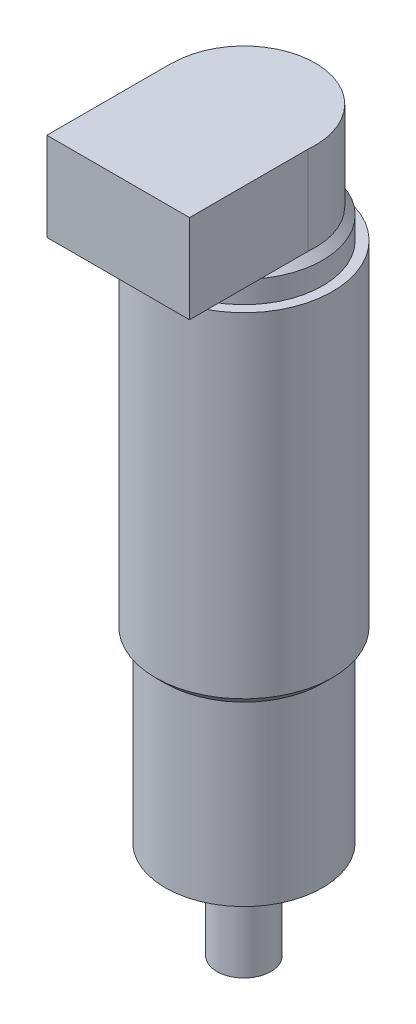
from build123d import *

# Parameters (mm, degrees)
ESQUISSE1_R        = 16
BOSS_EXTRU_1_DEPTH = 36
ESQUISSE2_R        = 18
BOSS_EXTRU_2_DEPTH = 70
CHANFREIN1_SIZE    = 2
ESQUISSE3_R        = 16
BOSS_EXTRU_3_DEPTH = 6
ESQUISSE4_R        = 14.5
BOSS_EXTRU_4_DEPTH = 18
CHANFREIN2_SIZE    = 1.5
ESQUISSE5_W        = 29
ESQUISSE5_H        = 18
BOSS_EXTRU_5_DEPTH = 25.5
ESQUISSE6_R        = 5.5
BOSS_EXTRU_6_DEPTH = 20


with BuildPart() as part:
    # Esquisse1 → Boss.-Extru.1 (new body)
    with BuildSketch(Plane(origin=(0, 0, 0), x_dir=(1, 0, 0), z_dir=(0, 1, 0))):
        with Locations(Location((0, 0, 0), (0, 0, 270))):
            Circle(ESQUISSE1_R)
    extrude(amount=BOSS_EXTRU_1_DEPTH)

    # Esquisse2 → Boss.-Extru.2 (add)
    with BuildSketch(Plane(origin=(0, 36, 0), x_dir=(1, 0, 0), z_dir=(0, 1, 0))):
        with Locations(Location((0, 0, 0), (0, 0, 270))):
            Circle(ESQUISSE2_R)
    extrude(amount=BOSS_EXTRU_2_DEPTH)

    # Chanfrein1
    chanfrein1_edges = [part.edges().sort_by_distance(p)[0] for p in [
        (0, 36, -18),
    ]]
    chamfer(chanfrein1_edges, length=CHANFREIN1_SIZE - 0.0001)  # a hair under: the kernel refuses the full size

    # Esquisse3 → Boss.-Extru.3 (add)
    with BuildSketch(Plane(origin=(0, 106, 0), x_dir=(1, 0, 0), z_dir=(0, 1, 0))):
        with Locations(Location((0, 0, 0), (0, 0, 270))):
            Circle(ESQUISSE3_R)
    extrude(amount=BOSS_EXTRU_3_DEPTH)

    # Esquisse4 → Boss.-Extru.4 (add)
    with BuildSketch(Plane(origin=(0, 112, 0), x_dir=(1, 0, 0), z_dir=(0, 1, 0))):
        with Locations(Location((0, 0, 0), (0, 0, 270))):
            Circle(ESQUISSE4_R)
    extrude(amount=BOSS_EXTRU_4_DEPTH)

    # Chanfrein2
    chanfrein2_edges = [part.edges().sort_by_distance(p)[0] for p in [
        (0, 112, -16),
    ]]
    chamfer(chanfrein2_edges, length=CHANFREIN2_SIZE - 0.0001)  # a hair under: the kernel refuses the full size

    # Esquisse5 → Boss.-Extru.5 (add)
    with BuildSketch(Plane.XY):
        with Locations((-0.063832193, 121)):
            Rectangle(ESQUISSE5_W, ESQUISSE5_H)
    extrude(amount=BOSS_EXTRU_5_DEPTH)

    # Esquisse6 → Boss.-Extru.6 (add)
    with BuildSketch(Plane.XZ):
        with Locations(Location((0, 0, 0), (0, 0, 90))):
            Circle(ESQUISSE6_R)
    extrude(amount=BOSS_EXTRU_6_DEPTH)


solid = part.part
